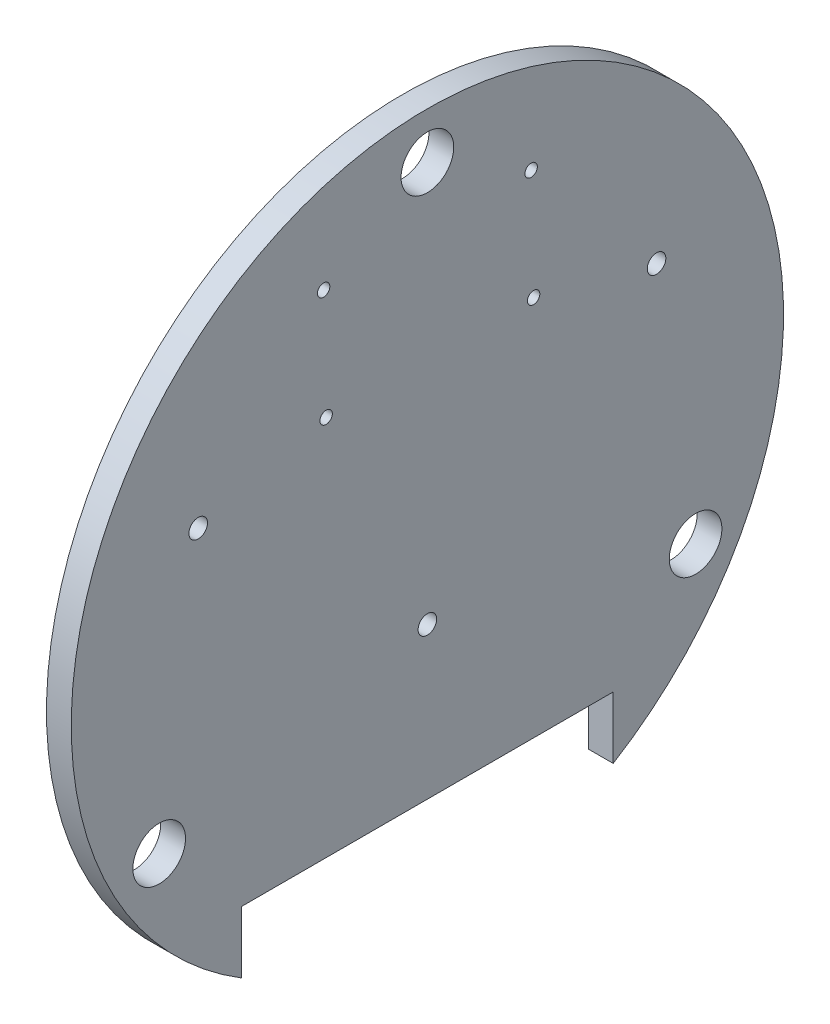
from build123d import *

# Parameters (mm, degrees)
SKETCH1_R           = 57.5
BOSS_EXTRUDE1_DEPTH = 4
SKETCH2_R           = 4.25
CUT_EXTRUDE1_DEPTH  = 82.415600471
CUT_EXTRUDE2_DEPTH  = 82.415600471
SKETCH4_R           = 1
SKETCH4_R_2         = 1.5
CUT_EXTRUDE3_DEPTH  = 82.415600471


with BuildPart() as part:
    # Sketch1 → Boss-Extrude1 (new body)
    with BuildSketch(Plane(origin=(0, 0, 0), x_dir=(0, 0, -1), z_dir=(1, 0, 0))):
        Circle(SKETCH1_R)
    extrude(amount=BOSS_EXTRUDE1_DEPTH)

    # Sketch2 → Cut-Extrude1 (cut, through all)
    with BuildSketch(Plane.ZY):
        with Locations((0, 50)):
            Circle(SKETCH2_R)
        with Locations((43.301270189, -25)):
            Circle(SKETCH2_R)
        with Locations((-43.301270189, -25)):
            Circle(SKETCH2_R)
    extrude(amount=-CUT_EXTRUDE1_DEPTH, mode=Mode.SUBTRACT)

    # Sketch3 → Cut-Extrude2 (cut, through all)
    with BuildSketch(Plane.ZY):
        with BuildLine():
            Line((-30, -49.053542176), (-30, -39.053542176))
            Line((-30, -39.053542176), (30, -39.053542176))
            Line((30, -39.053542176), (30, -49.053542176))
            ThreePointArc((30, -49.053542176), (0, -57.5), (-30, -49.053542176))
        make_face()
    extrude(amount=-CUT_EXTRUDE2_DEPTH, mode=Mode.SUBTRACT)

    # Sketch4 → Cut-Extrude3 (cut, through all)
    with BuildSketch(Plane(origin=(4, 0, 0), x_dir=(0, 0, -1), z_dir=(1, 0, 0))):
        with Locations((-16.75, 40.516471667)):
            Circle(SKETCH4_R)
        with Locations((16.75, 40.516471667)):
            Circle(SKETCH4_R)
        with Locations((17.152725495, 22.520977448)):
            Circle(SKETCH4_R)
        with Locations((-16.347274505, 22.520977448)):
            Circle(SKETCH4_R)
        with Locations((-37, 17.342133915)):
            Circle(SKETCH4_R_2)
        with Locations((0, -14.61301732)):
            Circle(SKETCH4_R_2)
        with Locations((37, 17.342133915)):
            Circle(SKETCH4_R_2)
    extrude(amount=-CUT_EXTRUDE3_DEPTH, mode=Mode.SUBTRACT)


solid = part.part
